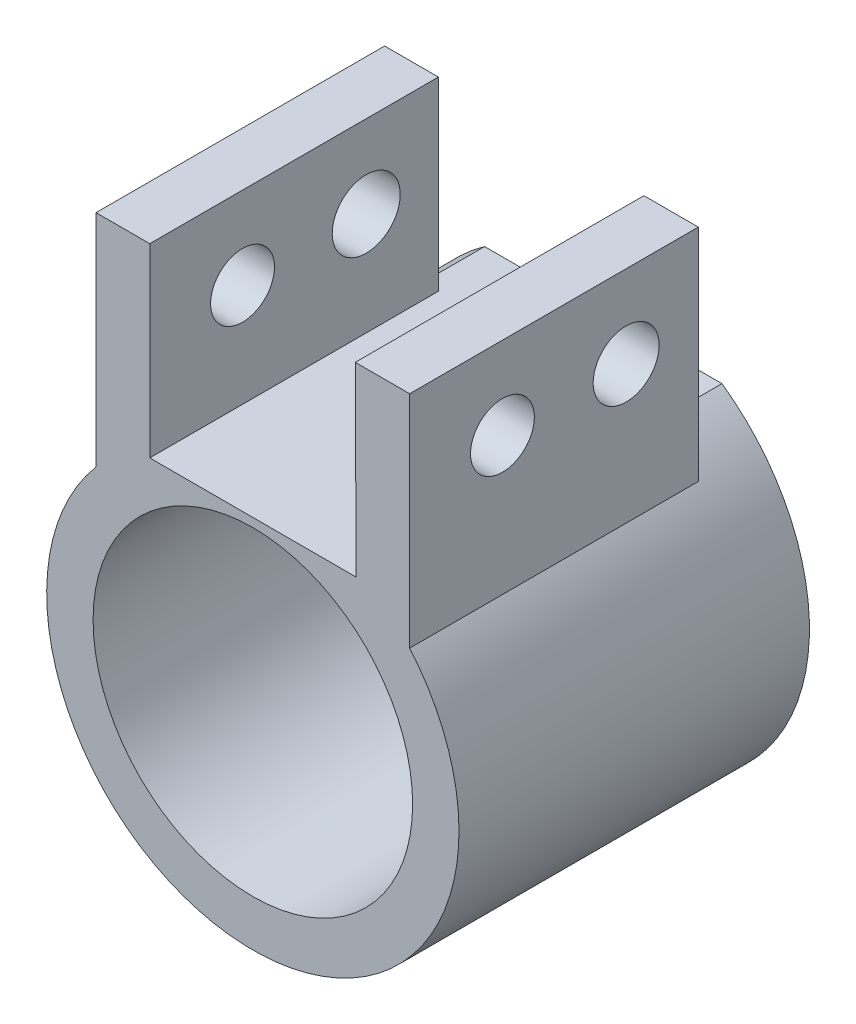
from build123d import *

# Parameters (mm, degrees)
SKETCH_1_R           = 14.75
EXTRUDE_1_DEPTH      = 1
SKETCH_2_R           = 1.5
CUT_EXTRUDE_1_DEPTH  = 1
SKETCH_3_R           = 1.1
CUT_EXTRUDE_2_DEPTH  = 1
SKETCH_4_R           = 3.5
CUT_EXTRUDE_3_DEPTH  = 4
SKETCH_5_OUTSIDE_W   = 39.846
SKETCH_5_OUTSIDE_H   = 39.846
SKETCH_5_OUTSIDE_R   = 7
CUT_EXTRUDE_4_DEPTH  = 10
SKETCH_6_R           = 8.75
SKETCH_6_R_2         = 6.75
EXTRUDE_1_2_DEPTH    = 10
SKETCH_7_W           = 20
SKETCH_7_H           = 5.176336695
EXTRUDE_2_DEPTH      = 9
CUT_EXTRUDE_5_DEPTH  = 2
SKETCH_9_W           = 10
SKETCH_9_H           = 4
CUT_EXTRUDE_6_DEPTH  = 12
CHAMFER_START        = 3
CHAMFER_2_DEPTH      = 7
SKETCH_10_W          = 5
SKETCH_10_H          = 7
SKETCH_10_W_2        = 5.030534445
EXTRUDE_3_DEPTH      = 5
SKETCH_11_W          = 0.39232609
SKETCH_11_H          = 7
CUT_EXTRUDE_7_DEPTH  = 22
SKETCH_12_W          = 2
SKETCH_12_H          = 7
CUT_EXTRUDE_8_DEPTH  = 12
SKETCH_13_R          = 1.65
CUT_EXTRUDE_9_DEPTH  = 10
SKETCH_14_R          = 1.6
CUT_EXTRUDE_10_DEPTH = 24
SKETCH_15_R          = 7.75
CUT_EXTRUDE_11_DEPTH = 9
SKETCH_16_R          = 7.75
EXTRUDE_4_DEPTH      = 10
SKETCH_17_W          = 18.442899184
SKETCH_17_H          = 2.260029227
CUT_EXTRUDE_12_DEPTH = 3
EXTRUDE_START        = 7
SKETCH_18_R          = 7.75
EXTRUDE_5_DEPTH      = 7
SKETCH_19_R          = 1.55
CUT_EXTRUDE_13_DEPTH = 17


with BuildPart() as part:
    # 草图1 → Extrude 1 (new body)
    with BuildSketch(Plane.XY):
        Circle(SKETCH_1_R)
    extrude(amount=EXTRUDE_1_DEPTH)

    # 草图2 → 切除-拉伸1 (cut)
    with BuildSketch(Plane.XY.offset(1)):
        with Locations((-11.5, 0)):
            Circle(SKETCH_2_R)
        with Locations((11.5, 0)):
            Circle(SKETCH_2_R)
        with Locations((0, -11.5)):
            Circle(SKETCH_2_R)
    extrude(amount=-CUT_EXTRUDE_1_DEPTH, mode=Mode.SUBTRACT)

    # 草图3 → 切除-拉伸2 (cut)
    with BuildSketch(Plane.XY.offset(1)):
        with Locations((-5.5, 0)):
            Circle(SKETCH_3_R)
        with Locations((5.5, 0)):
            Circle(SKETCH_3_R)
    extrude(amount=-CUT_EXTRUDE_2_DEPTH, mode=Mode.SUBTRACT)

    # 草图4 → 切除-拉伸3 (cut)
    with BuildSketch(Plane(origin=(0, 0, 0), x_dir=(-1, 0, 0), z_dir=(0, 0, -1))):
        Circle(SKETCH_4_R)
    extrude(amount=-CUT_EXTRUDE_3_DEPTH, mode=Mode.SUBTRACT)

    # 草图5 outside → 切除-拉伸4 (cut)
    with BuildSketch(Plane(origin=(0, 0, 0), x_dir=(-1, 0, 0), z_dir=(0, 0, -1))):
        Rectangle(SKETCH_5_OUTSIDE_W, SKETCH_5_OUTSIDE_H)
        Circle(SKETCH_5_OUTSIDE_R, mode=Mode.SUBTRACT)
    extrude(amount=-CUT_EXTRUDE_4_DEPTH, mode=Mode.SUBTRACT)

    # 草图6 → Extrude 1 2 (add)
    with BuildSketch(Plane(origin=(0, 0, 0), x_dir=(-1, 0, 0), z_dir=(0, 0, -1))):
        Circle(SKETCH_6_R)
        Circle(SKETCH_6_R_2, mode=Mode.SUBTRACT)
    extrude(amount=-EXTRUDE_1_2_DEPTH)

    # 草图7 → 凸台-拉伸2 (add)
    with BuildSketch(Plane.XY.offset(1)):
        with Locations((0, 9.588168348)):
            Rectangle(SKETCH_7_W, SKETCH_7_H)
    extrude(amount=EXTRUDE_2_DEPTH)

    # 草图8 → 切除-拉伸5 (cut)
    with BuildSketch(Plane(origin=(0, 0, 1), x_dir=(-1, 0, 0), z_dir=(0, 0, -1))):
        with BuildLine():
            Line((5.25, 7), (10, 7))
            Line((10, 7), (10, 12.176336695))
            Line((10, 12.176336695), (-10, 12.176336695))
            Line((-10, 12.176336695), (-10, 7))
            Line((-10, 7), (-5.25, 7))
            ThreePointArc((-5.25, 7), (0, 8.75), (5.25, 7))
        make_face()
    extrude(amount=-CUT_EXTRUDE_5_DEPTH, mode=Mode.SUBTRACT)

    # 草图9 → 切除-拉伸6 (cut)
    with BuildSketch(Plane.XY.offset(10)):
        with Locations((0, 10.176336695)):
            Rectangle(SKETCH_9_W, SKETCH_9_H)
    extrude(amount=-CUT_EXTRUDE_6_DEPTH, mode=Mode.SUBTRACT)

    # 倒角1
    # the kernel refuses this chamfer: 5, 3.571428571 mm, written as the material it adds along each edge
    with BuildSketch(Plane(origin=(5.25, 7, 10), x_dir=(0.718685473033907, -0.6953353082146982, 0), z_dir=(0, 0, -1))) as chamfer_1_piece_1:
        with BuildLine():
            Line((2.129047938, 0.190960276), (3.191245845, -3.221004807))
            Line((3.191245845, -3.221004807), (3.121712315, -3.292873355))
            ThreePointArc((3.121712315, -3.292873355), (1.559431919, -1.647908743), (-0.069533531, -0.071868547))
            Line((-0.069533531, -0.071868547), (0.012505696, 0.099214956))
            ThreePointArc((0.012505696, 0.099214956), (1.064301984, 0.031360517), (2.116542242, 0.290175233))
            Line((2.116542242, 0.290175233), (2.129047938, 0.190960276))
        make_face()
    extrude(amount=7)

    # 倒角2: read off the stored shape, not the designer's step
    # 倒角2 outline → 倒角2 (add)
    with BuildSketch(Plane.XY.offset(CHAMFER_START)):
        with BuildLine():
            Line((-9.60767391, 7), (-6.822840892, 5.47826087))
            ThreePointArc((-6.822840892, 5.47826087), (-6.084183947, 6.288497889), (-5.25, 7))
            Line((-5.25, 7), (-9.60767391, 7))
        make_face()
    extrude(amount=CHAMFER_2_DEPTH)

    # 草图10 → 凸台-拉伸3 (add)
    with BuildSketch(Plane(origin=(0, 12.176336695, 0), x_dir=(1, 0, 0), z_dir=(0, 1, 0))):
        with Locations((-7.5, -6.5)):
            Rectangle(SKETCH_10_W, SKETCH_10_H)
        with Locations((7.484732777, -6.5)):
            Rectangle(SKETCH_10_W_2, SKETCH_10_H)
    extrude(amount=EXTRUDE_3_DEPTH)

    # 草图11 → 切除-拉伸7 (cut)
    with BuildSketch(Plane.XZ.offset(-7)):
        with Locations((-9.803836955, 6.5)):
            Rectangle(SKETCH_11_W, SKETCH_11_H)
        with Locations((9.803836955, 6.5)):
            Rectangle(SKETCH_11_W, SKETCH_11_H)
    extrude(amount=-CUT_EXTRUDE_7_DEPTH, mode=Mode.SUBTRACT)

    # 草图12 → 切除-拉伸8 (cut)
    with BuildSketch(Plane(origin=(0, 17.176336695, 0), x_dir=(1, 0, 0), z_dir=(0, 1, 0))):
        with Locations((-8.60767391, -6.5)):
            Rectangle(SKETCH_12_W, SKETCH_12_H)
        with Locations((8.60767391, -6.5)):
            Rectangle(SKETCH_12_W, SKETCH_12_H)
    extrude(amount=-CUT_EXTRUDE_8_DEPTH, mode=Mode.SUBTRACT)

    # 草图13 → 切除-拉伸9 (cut)
    with BuildSketch(Plane(origin=(-5, 0, 0), x_dir=(0, 0, -1), z_dir=(1, 0, 0))):
        with Locations(Location((-6.5, 13.176336695, 0), (0, 0, 90))):
            Circle(SKETCH_13_R)
    extrude(amount=-CUT_EXTRUDE_9_DEPTH, mode=Mode.SUBTRACT)

    # 草图14 → 切除-拉伸10 (cut)
    with BuildSketch(Plane(origin=(-5, 0, 0), x_dir=(0, 0, -1), z_dir=(1, 0, 0))):
        with Locations(Location((-6.5, 13.176336695, 0), (0, 0, 321.317812547))):
            Circle(SKETCH_14_R)
    extrude(amount=CUT_EXTRUDE_10_DEPTH, mode=Mode.SUBTRACT)

    # 倒角3
    # the kernel refuses this chamfer: 1, 0.862080288 mm, written as the material it adds along each edge
    with BuildSketch(Plane(origin=(-6.822840892, 5.47826087, 3), x_dir=(-0.8775324532256278, 0.47951725050910476, 0), z_dir=(0, 0, 1))) as chamfer_3_piece_1_section:
        with BuildLine():
            Line((0.991009207, -0.026752196), (0.072738558, 0.799334069))
            Line((0.072738558, 0.799334069), (0.052814761, 0.801078297))
            ThreePointArc((0.052814761, 0.801078297), (0.041497623, 0.398993566), (-0.019689565, 0.00351013))
            Line((-0.019689565, 0.00351013), (0, -0.02))
            ThreePointArc((0, -0.02), (0.495504604, -0.02), (0.991009207, -0.046752196))
            Line((0.991009207, -0.046752196), (0.991009207, -0.026752196))
        make_face()
    chamfer_3_piece_1 = extrude(amount=7, mode=Mode.PRIVATE)
    chamfer_3_piece_1 = split(chamfer_3_piece_1, bisect_by=Plane(origin=(-7.60767391, 5.47826087, 3), z_dir=(1, 0, 0)), keep=Keep.TOP, mode=Mode.PRIVATE)
    add(chamfer_3_piece_1)

    # 倒角4
    # the kernel refuses this chamfer: 1, 0.862080288 mm, written as the material it adds along each edge
    with BuildSketch(Plane(origin=(6.822840893, 5.47826087, 10), x_dir=(0.5907401034808368, -0.8068619027686523, 0), z_dir=(0, 0, -1))) as chamfer_4_piece_1_section:
        with BuildLine():
            Line((0.801958261, 0.032996956), (0.103787295, -0.985922474))
            Line((0.103787295, -0.985922474), (0.083960944, -0.988552263))
            ThreePointArc((0.083960944, -0.988552263), (0.045327257, -0.49383221), (-0.019826352, -0.002629788))
            Line((-0.019826352, -0.002629788), (0.000890684, 0.019980157))
            ThreePointArc((0.000890684, 0.019980157), (0.400985832, 0.011326106), (0.801067577, 0.052977113))
            Line((0.801067577, 0.052977113), (0.801958261, 0.032996956))
        make_face()
    chamfer_4_piece_1 = extrude(amount=7, mode=Mode.PRIVATE)
    chamfer_4_piece_1 = split(chamfer_4_piece_1, bisect_by=Plane(origin=(7.60767391, 5.47826087, 10), z_dir=(-1, 0, 0)), keep=Keep.TOP, mode=Mode.PRIVATE)
    add(chamfer_4_piece_1)

    # 草图15 → 切除-拉伸11 (cut)
    with BuildSketch(Plane.XY.offset(10)):
        Circle(SKETCH_15_R)
    extrude(amount=-CUT_EXTRUDE_11_DEPTH, mode=Mode.SUBTRACT)

    # 草图16 → 凸台-拉伸4 (add)
    with BuildSketch(Plane.XY.offset(10)):
        with BuildLine():
            Line((-5, 8.660254038), (-5, 8.176336695))
            Line((-5, 8.176336695), (5, 8.176336695))
            Line((5, 8.176336695), (5, 8.660254038))
            ThreePointArc((5, 8.660254038), (0, -10), (-5, 8.660254038))
        make_face()
        Circle(SKETCH_16_R, mode=Mode.SUBTRACT)
    extrude(amount=-EXTRUDE_4_DEPTH)

    # 草图17 → 切除-拉伸12 (cut)
    with BuildSketch(Plane(origin=(0, 0, 0), x_dir=(-1, 0, 0), z_dir=(0, 0, -1))):
        with Locations((-0.125316737, 9.306351309)):
            Rectangle(SKETCH_17_W, SKETCH_17_H)
    extrude(amount=-CUT_EXTRUDE_12_DEPTH, mode=Mode.SUBTRACT)

    # 草图18 → 凸台-拉伸5 (add)
    with BuildSketch(Plane.XY.offset(10).offset(EXTRUDE_START)):
        with BuildLine():
            Line((-5, 17.176336695), (-7.60767391, 17.176336695))
            Line((-7.60767391, 17.176336695), (-7.60767391, 6.49024635))
            ThreePointArc((-7.60767391, 6.49024635), (0, -10), (7.60767391, 6.49024635))
            Line((7.60767391, 6.49024635), (7.60767391, 17.176336695))
            Line((7.60767391, 17.176336695), (4.969465555, 17.176336695))
            Line((4.969465555, 17.176336695), (4.969465555, 12.176336695))
            Line((4.969465555, 12.176336695), (5, 12.176336695))
            Line((5, 12.176336695), (5, 8.176336695))
            Line((5, 8.176336695), (-5, 8.176336695))
            Line((-5, 8.176336695), (-5, 17.176336695))
        make_face()
        Circle(SKETCH_18_R, mode=Mode.SUBTRACT)
    extrude(amount=-EXTRUDE_5_DEPTH)

    # 草图19 → 切除-拉伸13 (cut)
    with BuildSketch(Plane(origin=(7.60767391, 0, 0), x_dir=(0, 0, -1), z_dir=(1, 0, 0))):
        with Locations((-12.5, 13.176336695)):
            Circle(SKETCH_19_R)
    extrude(amount=-CUT_EXTRUDE_13_DEPTH, mode=Mode.SUBTRACT)


solid = part.part
